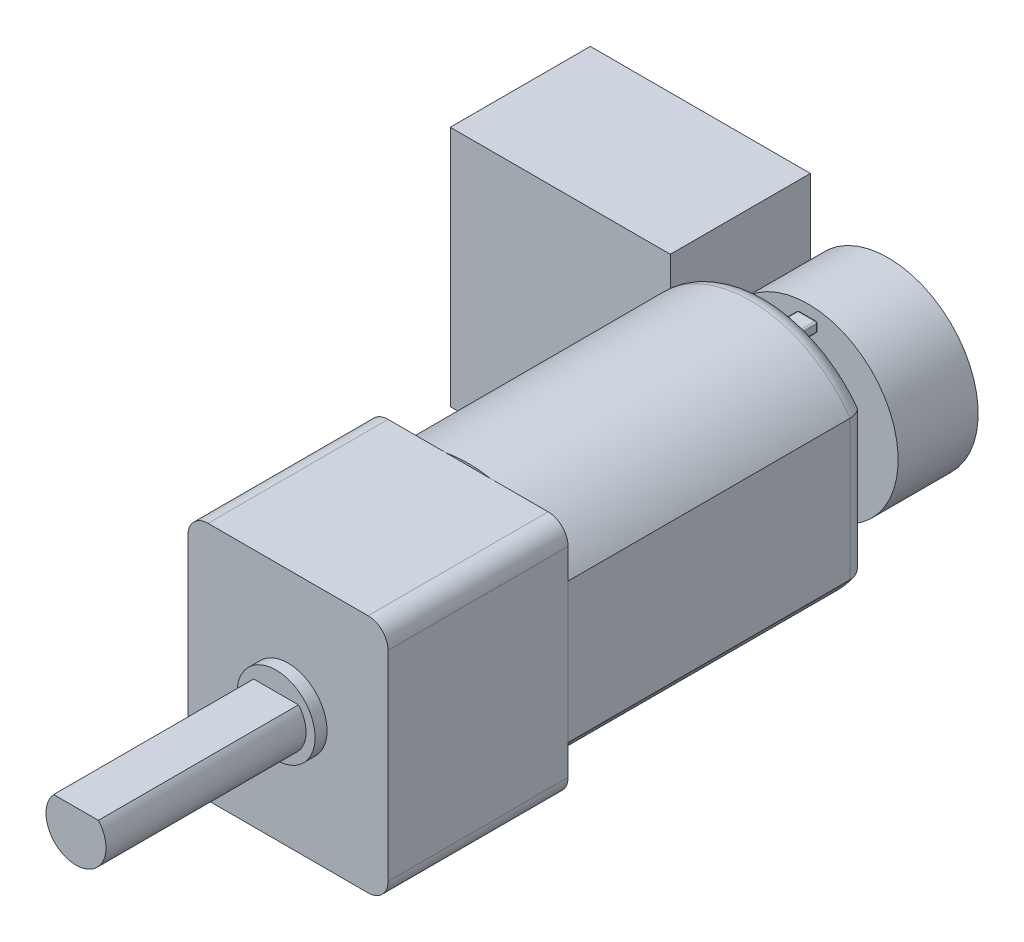
from build123d import *

# Parameters (mm, degrees)
CROQUIS1_W               = 10
CROQUIS1_H               = 12
SALIENTE_EXTRUIR1_DEPTH  = 9
SALIENTE_EXTRUIR2_DEPTH  = 15
CROQUIS3_W               = 1
CROQUIS3_H               = 0.5
SALIENTE_EXTRUIR3_DEPTH  = 2
CROQUIS4_R               = 2.5000000000000004
SALIENTE_EXTRUIR4_DEPTH  = 2
CROQUIS5_R               = 1.95
SALIENTE_EXTRUIR5_DEPTH  = 0.6
SALIENTE_EXTRUIR9_DEPTH  = 10
CROQUIS7_W               = 15.000000000000002
CROQUIS7_H               = 7.000000000000002
CORTAR_EXTRUIR1_DEPTH    = 0.01
CROQUIS8_W               = 15.000000000000002
CROQUIS8_H               = 7.0000000000000036
CORTAR_EXTRUIR2_DEPTH    = 0.01
REDONDEO1_R              = 0.9
REDONDEO2_R              = 0.9
REDONDEO3_R              = 0.5
CROQUIS9_R               = 0.4628353533662974
SALIENTE_EXTRUIR7_DEPTH  = 0.01
REDONDEO4_R              = 0.09
REDONDEO6_R              = 1
SKETCH2_R                = 4.5
BOSS_EXTRUDE1_DEPTH      = 4
BOSS_EXTRUDE3_DEPTH      = 10
BOSS_EXTRUDE3_DEPTH_BACK = 1


with BuildPart() as part:
    # Croquis1 → Saliente-Extruir1 (new body)
    with BuildSketch(Plane.XY):
        with Locations((5, 6)):
            Rectangle(CROQUIS1_W, CROQUIS1_H)
    extrude(amount=SALIENTE_EXTRUIR1_DEPTH)

    # Croquis2 → Saliente-Extruir2 (add)
    with BuildSketch(Plane(origin=(0, 0, 0), x_dir=(-1, 0, 0), z_dir=(0, 0, -1))):
        with BuildLine():
            Line((-10, 9.5), (-10, 2.5))
            ThreePointArc((-10, 2.5), (-5, -0.10327780786685103), (0, 2.5000000000000004))
            Line((0, 2.5000000000000004), (0, 9.5))
            ThreePointArc((0, 9.5), (-5, 12.103277807866851), (-10, 9.5))
        make_face()
    extrude(amount=SALIENTE_EXTRUIR2_DEPTH)

    # Croquis3 → Saliente-Extruir3 (add)
    with BuildSketch(Plane(origin=(0, 0, -15), x_dir=(-1, 0, 0), z_dir=(0, 0, -1))):
        with Locations((-5.000000000000001, 9.748277807866852)):
            Rectangle(CROQUIS3_W, CROQUIS3_H)
        Polygon((-5.499999999999999, 1.520287769635288), (-4.499999999999999, 1.5202877696352886), (-4.499999999999999, 1.020287769635288), (-5.499999999999999, 1.020287769635288), align=None)
    extrude(amount=SALIENTE_EXTRUIR3_DEPTH)

    # Croquis4 → Saliente-Extruir4 (add)
    with BuildSketch(Plane(origin=(0, 0, -15), x_dir=(-1, 0, 0), z_dir=(0, 0, -1))):
        with Locations(Location((-5, 6, 0), (0, 0, 180))):
            Circle(CROQUIS4_R)
    extrude(amount=SALIENTE_EXTRUIR4_DEPTH)

    # Croquis5 → Saliente-Extruir5 (add)
    with BuildSketch(Plane.XY.offset(9)):
        with Locations(Location((5, 6, 0), (0, 0, 180))):
            Circle(CROQUIS5_R)
    extrude(amount=SALIENTE_EXTRUIR5_DEPTH)

    # Croquis6 → Saliente-Extruir9 (add)
    with BuildSketch(Plane.XY.offset(9.6)):
        with BuildLine():
            Line((3.8819660112501033, 6.999999999999999), (6.118033988749897, 6.999999999999999))
            ThreePointArc((6.118033988749897, 6.999999999999999), (5, 4.499999999999999), (3.8819660112501033, 6.999999999999999))
        make_face()
    extrude(amount=SALIENTE_EXTRUIR9_DEPTH)

    # Croquis7 → Cortar-Extruir1 (cut)
    with BuildSketch(Plane(origin=(10, 0, 0), x_dir=(0, 0, -1), z_dir=(1, 0, 0))):
        with Locations((7.500000000000001, 5.999999999999999)):
            Rectangle(CROQUIS7_W, CROQUIS7_H)
    extrude(amount=-CORTAR_EXTRUIR1_DEPTH, mode=Mode.SUBTRACT)

    # Croquis8 → Cortar-Extruir2 (cut)
    with BuildSketch(Plane.ZY):
        with Locations((-7.500000000000001, 5.999999999999998)):
            Rectangle(CROQUIS8_W, CROQUIS8_H)
    extrude(amount=-CORTAR_EXTRUIR2_DEPTH, mode=Mode.SUBTRACT)

    # Redondeo1
    redondeo1_edges = [part.edges().sort_by_distance(p)[0] for p in [
        (9.99, 6, -15),
        (0.01, 5.999999999999998, -15),
    ]]
    fillet(redondeo1_edges, radius=REDONDEO1_R)

    # Redondeo2
    # the kernel refuses this fillet: 0.9 mm, written as the material it takes off along each edge
    with BuildSketch(Plane(origin=(5, 6.000000000000001, -15), x_dir=(-0.9708964954680348, 0.23949946782381015, 0), z_dir=(-0.23949946782381015, -0.9708964954680348, 0))) as redondeo2_piece_1:
        with BuildLine():
            CenterArc((6.103277807866849 - REDONDEO2_R, -REDONDEO2_R), REDONDEO2_R, 0, 90)
            Line((6.103277807866849, -REDONDEO2_R), (6.103277807866849, 0))
            Line((6.103277807866849, 0), (6.103277807866849 - REDONDEO2_R, 0))
        make_face()
    revolve(axis=Axis((5, 6.000000000000001, -15), (0, 0, -1)), revolution_arc=152.28599911771772, mode=Mode.SUBTRACT)
    with BuildSketch(Plane(origin=(5, 6, -15), x_dir=(0.9708964954680347, -0.23949946782381032, 0), z_dir=(0.23949946782381032, 0.9708964954680347, 0))) as redondeo2_piece_2:
        with BuildLine():
            CenterArc((6.103277807866849 - REDONDEO2_R, -REDONDEO2_R), REDONDEO2_R, 0, 90)
            Line((6.103277807866849 - REDONDEO2_R, 0), (6.103277807866849, 0))
            Line((6.103277807866849, 0), (6.103277807866849, -REDONDEO2_R))
        make_face()
    revolve(axis=Axis((5, 6, -15), (0, 0, -1)), revolution_arc=152.2859991177177, mode=Mode.SUBTRACT)

    # Redondeo3
    redondeo3_edges = [part.edges().sort_by_distance(p)[0] for p in [
        (2.4999999999999996, 5.999999999999999, -17),
    ]]
    fillet(redondeo3_edges, radius=REDONDEO3_R)

    # Croquis9 → Saliente-Extruir7 (add)
    with BuildSketch(Plane(origin=(0, 0, -17), x_dir=(-1, 0, 0), z_dir=(0, 0, -1))):
        with Locations((-5, 6)):
            Circle(CROQUIS9_R)
    extrude(amount=SALIENTE_EXTRUIR7_DEPTH)

    # Redondeo4
    redondeo4_edges = [part.edges().sort_by_distance(p)[0] for p in [
        (5.500000000000001, 9.998277807866852, -16),
        (5.500000000000001, 9.498277807866852, -16),
        (4.500000000000001, 9.498277807866852, -16),
        (4.500000000000001, 9.998277807866852, -16),
        (5.500000000000001, 9.748277807866852, -17),
        (5.000000000000001, 9.498277807866852, -17),
        (4.500000000000001, 9.748277807866852, -17),
        (5.000000000000001, 9.998277807866852, -17),
        (5.499999999999999, 1.520287769635288, -16),
        (5.499999999999999, 1.020287769635288, -16),
        (4.499999999999999, 1.020287769635288, -16),
        (4.499999999999999, 1.5202877696352886, -16),
        (5.499999999999999, 1.270287769635288, -17),
        (4.999999999999999, 1.020287769635288, -17),
        (4.499999999999999, 1.2702877696352883, -17),
        (4.999999999999999, 1.5202877696352883, -17),
    ]]
    fillet(redondeo4_edges, radius=REDONDEO4_R)

    # Redondeo6
    redondeo6_edges = [part.edges().sort_by_distance(p)[0] for p in [
        (10, 12, 4.5),
        (10, 0, 4.5),
        (0, 0, 4.5),
        (0, 12, 4.5),
    ]]
    fillet(redondeo6_edges, radius=REDONDEO6_R)

    # Sketch2 → Boss-Extrude1 (add)
    with BuildSketch(Plane(origin=(0, 0, -17), x_dir=(-1, 0, 0), z_dir=(0, 0, -1))):
        with Locations((-5, 6)):
            Circle(SKETCH2_R)
    extrude(amount=BOSS_EXTRUDE1_DEPTH)

    # Sketch3 → Boss-Extrude3 (add, two sides: drawn at the far end of the back side and taken through both)
    with BuildSketch(Plane.ZY.offset(-0.01).offset(-BOSS_EXTRUDE3_DEPTH_BACK)):
        Polygon((-14.100000000000003, 12.103277807866851), (-21.100000000000005, 12.103277807866851), (-21.1, 0), (-14.100000000000003, 0), align=None)
    extrude(amount=BOSS_EXTRUDE3_DEPTH + BOSS_EXTRUDE3_DEPTH_BACK)


solid = part.part
